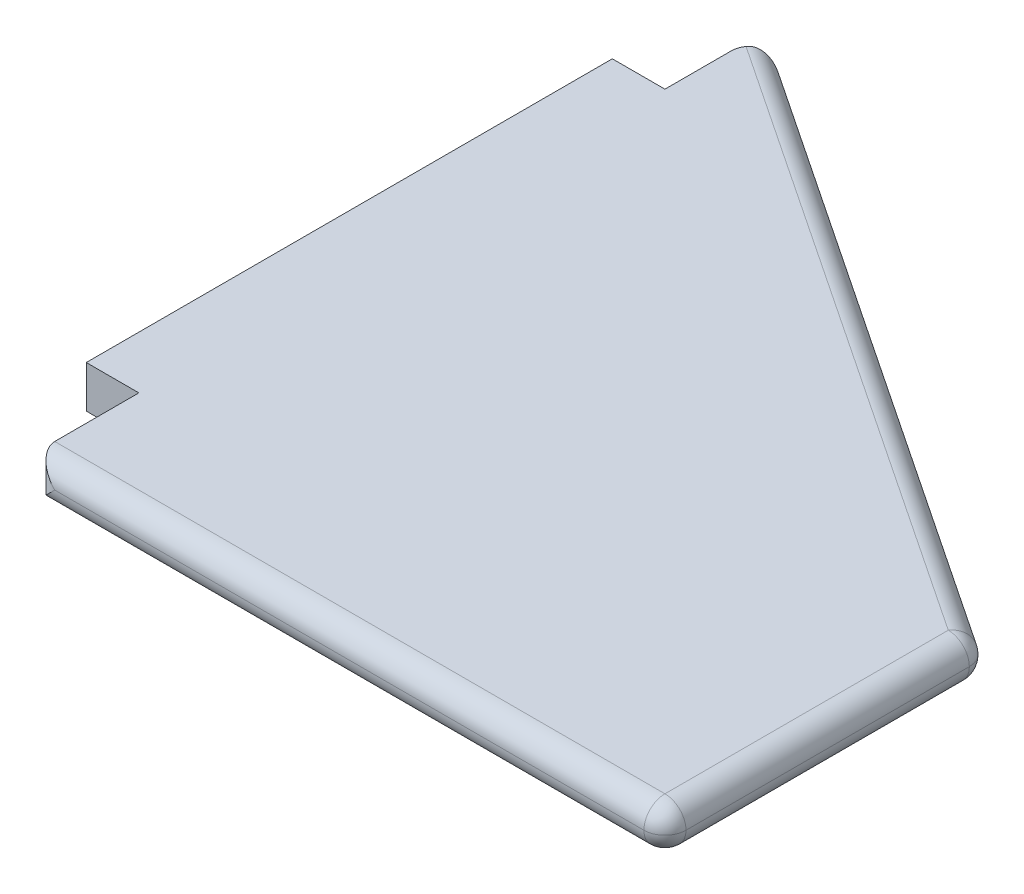
from build123d import *

# Parameters (mm, degrees)
BOSS_EXTRUDE1_DEPTH = 2.54
FILLET1_R           = 1.27


with BuildPart() as part:
    # Sketch1 → Boss-Extrude1 (new body)
    with BuildSketch(Plane(origin=(0, 0, 0), x_dir=(1, 0, 0), z_dir=(0, 1, 0))):
        Polygon((0, 0), (0, 31.75), (3.175, 31.75), (3.175, 38.1), (41.275, 12.7), (41.275, -6.35), (3.175, -6.35), (3.175, 0), align=None)
    extrude(amount=BOSS_EXTRUDE1_DEPTH)

    # Fillet1
    fillet1_edges = [part.edges().sort_by_distance(p)[0] for p in [
        (41.275, 0, -3.175),
        (22.225, 0, 6.35),
        (22.225, 2.54, 6.35),
        (3.175, 1.27, -38.1),
        (41.275, 1.27, -12.7),
        (41.275, 1.27, 6.35),
        (3.175, 1.27, 6.35),
        (41.275, 2.54, -3.175),
        (22.225, 2.54, -25.4),
        (22.225, 0, -25.4),
    ]]
    fillet(fillet1_edges, radius=FILLET1_R - 0.0001)  # a hair under: the kernel refuses the full size


solid = part.part
